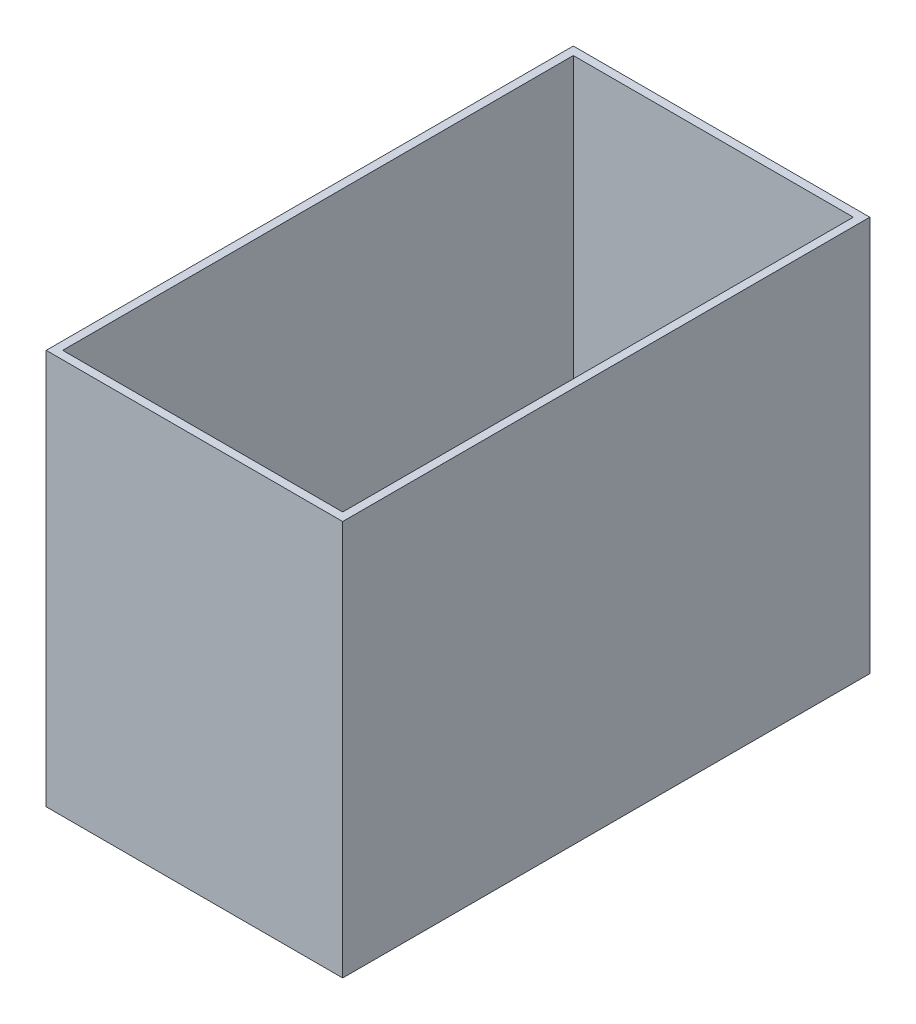
from build123d import *

# Parameters (mm, degrees)
SKETCH1_W           = 228.6
SKETCH1_H           = 406.4
BOSS_EXTRUDE1_DEPTH = 304.8
SKETCH2_W           = 215.9
SKETCH2_H           = 393.7
CUT_EXTRUDE1_DEPTH  = 298.45


with BuildPart() as part:
    # Sketch1 → Boss-Extrude1 (new body)
    with BuildSketch(Plane(origin=(0, 0, 0), x_dir=(1, 0, 0), z_dir=(0, 1, 0))):
        with Locations((114.3, 203.2)):
            Rectangle(SKETCH1_W, SKETCH1_H)
    extrude(amount=BOSS_EXTRUDE1_DEPTH)

    # Sketch2 → Cut-Extrude1 (cut)
    with BuildSketch(Plane(origin=(0, 304.8, 0), x_dir=(1, 0, 0), z_dir=(0, 1, 0))):
        with Locations((114.3, 203.2)):
            Rectangle(SKETCH2_W, SKETCH2_H)
    extrude(amount=-CUT_EXTRUDE1_DEPTH, mode=Mode.SUBTRACT)


solid = part.part
